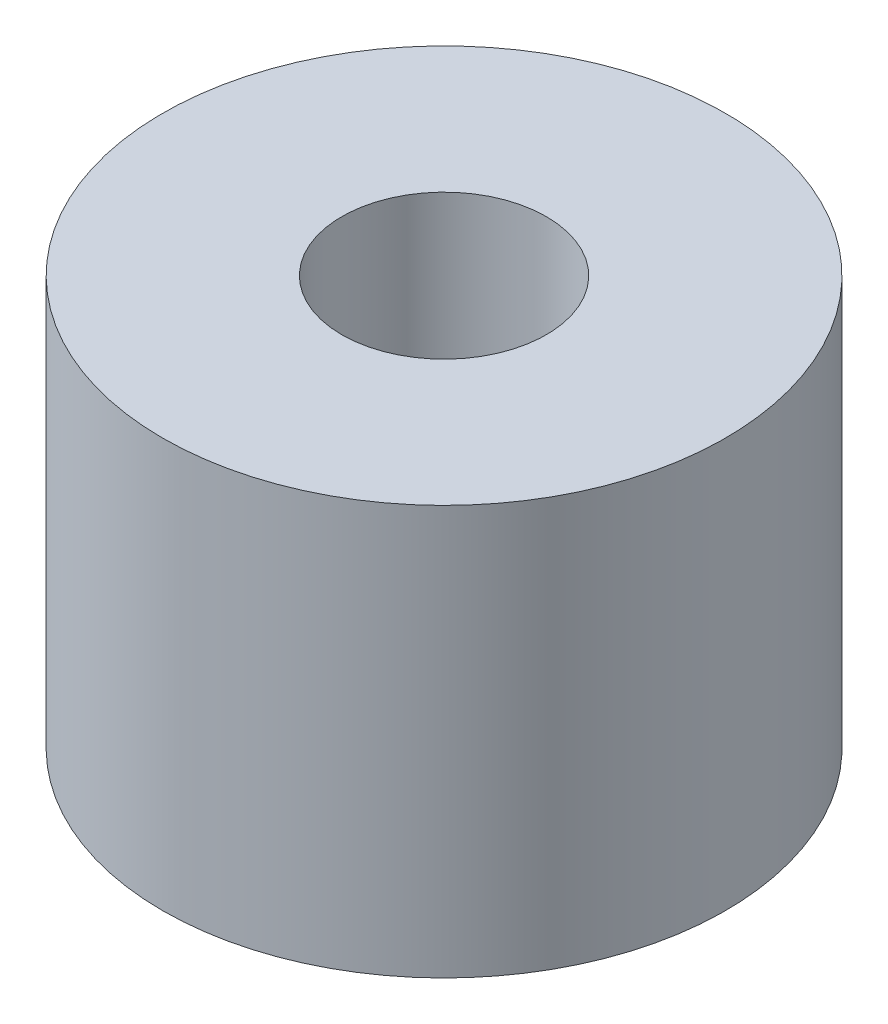
from build123d import *

# Parameters (mm, degrees)
SKETCH_1_R      = 5.5
SKETCH_1_R_2    = 2
EXTRUDE_1_DEPTH = 8


with BuildPart() as part:
    # Эскиз1 → Бобышка-Вытянуть1 (new body)
    with BuildSketch(Plane(origin=(0, 0, 0), x_dir=(1, 0, 0), z_dir=(0, 1, 0))):
        Circle(SKETCH_1_R)
        Circle(SKETCH_1_R_2, mode=Mode.SUBTRACT)
    extrude(amount=EXTRUDE_1_DEPTH)


solid = part.part
